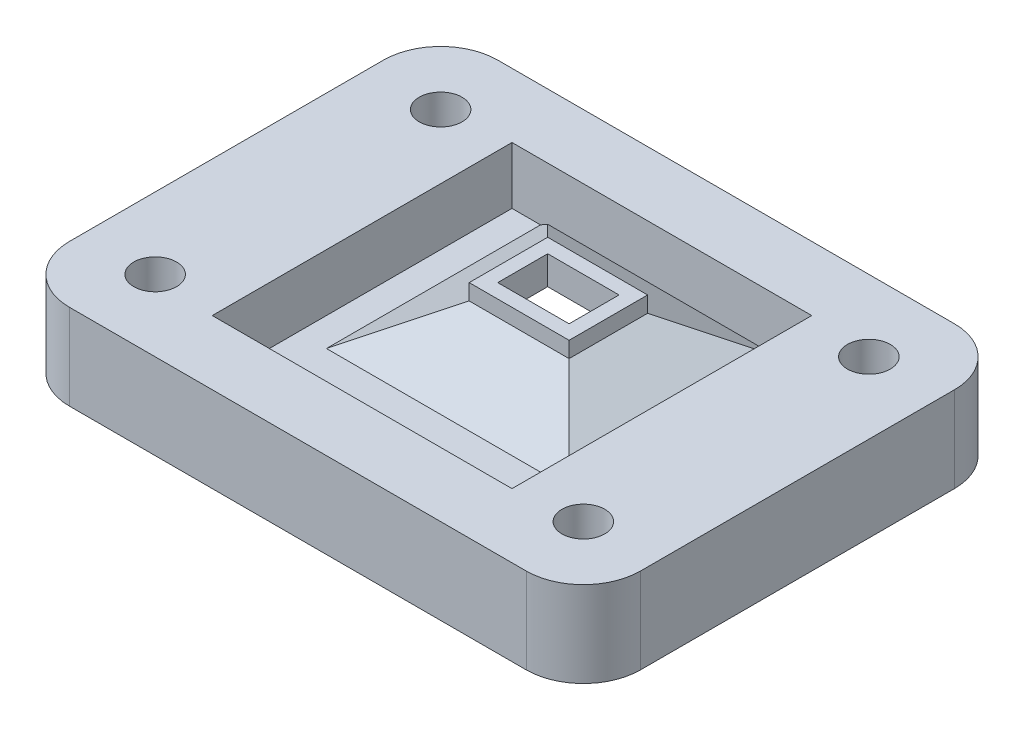
from build123d import *
from OCP.BRepFilletAPI import BRepFilletAPI_MakeChamfer

# Parameters (mm, degrees)
SKETCH1_W           = 40
SKETCH1_H           = 30
BOSS_EXTRUDE1_DEPTH = 6
SKETCH2_R           = 1.5
CUT_EXTRUDE1_DEPTH  = 6
FILLET1_R           = 4
SKETCH3_W           = 21
SKETCH3_H           = 21
CUT_EXTRUDE2_DEPTH  = 4
SKETCH6_W           = 5
SKETCH6_H           = 3.5
CUT_EXTRUDE3_DEPTH  = 2
SKETCH7_W           = 7
SKETCH7_H           = 5.5
SKETCH7_W_2         = 5
SKETCH7_H_2         = 3.5
BOSS_EXTRUDE2_DEPTH = 4
CHAMFER1_SIZE       = 4
CHAMFER1_SIZE2      = 6.92820323
CHAMFER2_SIZE       = 2.886751346
CHAMFER2_SIZE_2     = 5


with BuildPart() as part:
    # Sketch1 → Boss-Extrude1 (new body)
    with BuildSketch(Plane(origin=(0, 0, 0), x_dir=(1, 0, 0), z_dir=(0, 1, 0))):
        with Locations((20, 15)):
            Rectangle(SKETCH1_W, SKETCH1_H)
    extrude(amount=BOSS_EXTRUDE1_DEPTH)

    # Sketch2 → Cut-Extrude1 (cut)
    with BuildSketch(Plane(origin=(0, 6, 0), x_dir=(1, 0, 0), z_dir=(0, 1, 0))):
        with Locations(Location((5, 5, 0), (0, 0, 270))):
            Circle(SKETCH2_R)
        with Locations(Location((5, 25, 0), (0, 0, 90))):
            Circle(SKETCH2_R)
        with Locations(Location((35, 5, 0), (0, 0, 90))):
            Circle(SKETCH2_R)
        with Locations(Location((35, 25, 0), (0, 0, 270))):
            Circle(SKETCH2_R)
    extrude(amount=-CUT_EXTRUDE1_DEPTH, mode=Mode.SUBTRACT)

    # Fillet1
    fillet1_edges = [part.edges().sort_by_distance(p)[0] for p in [
        (0, 3, -30),
        (40, 3, -30),
        (40, 3, 0),
        (0, 3, 0),
    ]]
    fillet(fillet1_edges, radius=FILLET1_R)

    # Sketch3 → Cut-Extrude2 (cut)
    with BuildSketch(Plane(origin=(0, 6, 0), x_dir=(1, 0, 0), z_dir=(0, 1, 0))):
        with Locations((20, 15)):
            Rectangle(SKETCH3_W, SKETCH3_H)
    extrude(amount=-CUT_EXTRUDE2_DEPTH, mode=Mode.SUBTRACT)

    # Sketch6 → Cut-Extrude3 (cut)
    with BuildSketch(Plane(origin=(0, 2, 0), x_dir=(1, 0, 0), z_dir=(0, 1, 0))):
        with Locations((20, 18.25)):
            Rectangle(SKETCH6_W, SKETCH6_H)
    extrude(amount=-CUT_EXTRUDE3_DEPTH, mode=Mode.SUBTRACT)

    # Sketch7 → Boss-Extrude2 (add)
    with BuildSketch(Plane(origin=(0, 2, 0), x_dir=(1, 0, 0), z_dir=(0, 1, 0))):
        with Locations((20, 18.25)):
            Rectangle(SKETCH7_W, SKETCH7_H)
        with Locations((20, 18.25)):
            Rectangle(SKETCH7_W_2, SKETCH7_H_2, mode=Mode.SUBTRACT)
    extrude(amount=BOSS_EXTRUDE2_DEPTH)

    # Chamfer1: one chamfer whose edges measure the first distance from different faces: ONE call of the kernel's chamfer builder (chamfer() names one face for all edges)
    chamfer1_edges_1 = [part.edges().sort_by_distance(p)[0] for p in [
        (20, 0, -16.5),
    ]]
    chamfer1_side_1 = [part.faces().sort_by_distance(p)[0] for p in [
        (20, 3, -16.5),
    ]]
    chamfer1_edges_2 = [part.edges().sort_by_distance(p)[0] for p in [
        (22.5, 0, -18.25),
    ]]
    chamfer1_side_2 = [part.faces().sort_by_distance(p)[0] for p in [
        (22.5, 3, -18.25),
    ]]
    chamfer1_edges_3 = [part.edges().sort_by_distance(p)[0] for p in [
        (20, 0, -20),
    ]]
    chamfer1_side_3 = [part.faces().sort_by_distance(p)[0] for p in [
        (20, 3, -20),
    ]]
    chamfer1_edges_4 = [part.edges().sort_by_distance(p)[0] for p in [
        (17.5, 0, -18.25),
    ]]
    chamfer1_side_4 = [part.faces().sort_by_distance(p)[0] for p in [
        (17.5, 3, -18.25),
    ]]
    chamfer1 = BRepFilletAPI_MakeChamfer(part.part.solid().wrapped)
    for e in chamfer1_edges_1:
        chamfer1.Add(CHAMFER1_SIZE, CHAMFER1_SIZE2, e.wrapped, chamfer1_side_1[0].wrapped)  # the first distance lies on this face
    for e in chamfer1_edges_2:
        chamfer1.Add(CHAMFER1_SIZE, CHAMFER1_SIZE2, e.wrapped, chamfer1_side_2[0].wrapped)  # the first distance lies on this face
    for e in chamfer1_edges_3:
        chamfer1.Add(CHAMFER1_SIZE, CHAMFER1_SIZE2, e.wrapped, chamfer1_side_3[0].wrapped)  # the first distance lies on this face
    for e in chamfer1_edges_4:
        chamfer1.Add(CHAMFER1_SIZE, CHAMFER1_SIZE2, e.wrapped, chamfer1_side_4[0].wrapped)  # the first distance lies on this face
    add(Compound.cast(chamfer1.Shape()), mode=Mode.REPLACE)

    # Chamfer2
    # the kernel refuses this chamfer: 5, 2.886751346 mm, written as the material it adds along each edge
    with BuildSketch(Plane(origin=(16.5, 2, -33.935428773), x_dir=(0, 1, 0), z_dir=(0, 0, 1))) as chamfer2_piece_1_section:
        Polygon((CHAMFER2_SIZE, 0), (0, CHAMFER2_SIZE_2), (0, 0), align=None)
    chamfer2_piece_1 = extrude(amount=31.370857546, mode=Mode.PRIVATE)
    chamfer2_piece_1 = split(chamfer2_piece_1, bisect_by=Plane(origin=(15.883974596, 3.066987298, -33.935428773), z_dir=(-0.499999999999998, 0.8660254037844398, 0)), keep=Keep.TOP, mode=Mode.PRIVATE)
    chamfer2_piece_1 = split(chamfer2_piece_1, bisect_by=Plane(origin=(16.5, -1.436141454, -31.95157158), z_dir=(0, -0.8660254037844382, 0.500000000000001)), keep=Keep.TOP, mode=Mode.PRIVATE)
    chamfer2_piece_1 = split(chamfer2_piece_1, bisect_by=Plane(origin=(16.5, 12.147838333, -28.07657158), z_dir=(0, -0.8660254037844382, -0.500000000000001)), keep=Keep.TOP, mode=Mode.PRIVATE)
    with BuildSketch(Plane(origin=(16.5, 2, -33.935428773), x_dir=(0, 1, 0), z_dir=(0, 0, 1))) as chamfer2_piece_2_section:
        Polygon((CHAMFER2_SIZE, 0), (0, CHAMFER2_SIZE_2), (0, 0), align=None)
    chamfer2_piece_2 = extrude(amount=31.370857546, mode=Mode.PRIVATE)
    chamfer2_piece_2 = split(chamfer2_piece_2, bisect_by=Plane(origin=(16.5, -2.534217665, -31.317596984), z_dir=(0, 0.8660254037844398, -0.499999999999998)), keep=Keep.TOP, mode=Mode.PRIVATE)
    chamfer2_piece_2 = split(chamfer2_piece_2, bisect_by=Plane(origin=(16.5, -1.436141454, -31.95157158), z_dir=(0, -0.8660254037844382, 0.500000000000001)), keep=Keep.TOP, mode=Mode.PRIVATE)
    with BuildSketch(Plane(origin=(16.5, 2, -33.935428773), x_dir=(0, 1, 0), z_dir=(0, 0, 1))) as chamfer2_piece_3_section:
        Polygon((CHAMFER2_SIZE, 0), (0, CHAMFER2_SIZE_2), (0, 0), align=None)
    chamfer2_piece_3 = extrude(amount=31.370857546, mode=Mode.PRIVATE)
    chamfer2_piece_3 = split(chamfer2_piece_3, bisect_by=Plane(origin=(16.5, 11.049762122, -28.710546176), z_dir=(0, 0.8660254037844398, 0.499999999999998)), keep=Keep.TOP, mode=Mode.PRIVATE)
    chamfer2_piece_3 = split(chamfer2_piece_3, bisect_by=Plane(origin=(16.5, 12.147838333, -28.07657158), z_dir=(0, -0.8660254037844382, -0.500000000000001)), keep=Keep.TOP, mode=Mode.PRIVATE)
    with BuildSketch(Plane(origin=(3.564571227, 2, -15.5), x_dir=(0, 1, 0), z_dir=(1, 0, 0))) as chamfer2_piece_4_section:
        Polygon((CHAMFER2_SIZE, 0), (0, CHAMFER2_SIZE_2), (0, 0), align=None)
    chamfer2_piece_4 = extrude(amount=32.870857546, mode=Mode.PRIVATE)
    chamfer2_piece_4 = split(chamfer2_piece_4, bisect_by=Plane(origin=(3.564571227, 3.066987298, -14.883974596), z_dir=(0, 0.8660254037844398, 0.499999999999998)), keep=Keep.TOP, mode=Mode.PRIVATE)
    chamfer2_piece_4 = split(chamfer2_piece_4, bisect_by=Plane(origin=(9.79842842, 12.797357386, -15.5), z_dir=(-0.500000000000001, -0.8660254037844382, 0)), keep=Keep.TOP, mode=Mode.PRIVATE)
    chamfer2_piece_4 = split(chamfer2_piece_4, bisect_by=Plane(origin=(5.54842842, -1.436141454, -15.5), z_dir=(0.500000000000001, -0.8660254037844382, 0)), keep=Keep.TOP, mode=Mode.PRIVATE)
    with BuildSketch(Plane(origin=(3.564571227, 2, -15.5), x_dir=(0, 1, 0), z_dir=(1, 0, 0))) as chamfer2_piece_5_section:
        Polygon((CHAMFER2_SIZE, 0), (0, CHAMFER2_SIZE_2), (0, 0), align=None)
    chamfer2_piece_5 = extrude(amount=32.870857546, mode=Mode.PRIVATE)
    chamfer2_piece_5 = split(chamfer2_piece_5, bisect_by=Plane(origin=(6.182403016, -2.534217665, -15.5), z_dir=(-0.499999999999998, 0.8660254037844398, 0)), keep=Keep.TOP, mode=Mode.PRIVATE)
    chamfer2_piece_5 = split(chamfer2_piece_5, bisect_by=Plane(origin=(5.54842842, -1.436141454, -15.5), z_dir=(0.500000000000001, -0.8660254037844382, 0)), keep=Keep.TOP, mode=Mode.PRIVATE)
    with BuildSketch(Plane(origin=(23.5, 2, -2.564571227), x_dir=(0, 1, 0), z_dir=(0, 0, -1))) as chamfer2_piece_6_section:
        Polygon((CHAMFER2_SIZE, 0), (0, CHAMFER2_SIZE_2), (0, 0), align=None)
    chamfer2_piece_6 = extrude(amount=31.370857546, mode=Mode.PRIVATE)
    chamfer2_piece_6 = split(chamfer2_piece_6, bisect_by=Plane(origin=(24.116025404, 3.066987298, -2.564571227), z_dir=(0.499999999999998, 0.8660254037844398, 0)), keep=Keep.TOP, mode=Mode.PRIVATE)
    chamfer2_piece_6 = split(chamfer2_piece_6, bisect_by=Plane(origin=(23.5, 12.147838333, -8.42342842), z_dir=(0, -0.8660254037844382, 0.500000000000001)), keep=Keep.TOP, mode=Mode.PRIVATE)
    chamfer2_piece_6 = split(chamfer2_piece_6, bisect_by=Plane(origin=(23.5, -1.436141454, -4.54842842), z_dir=(0, -0.8660254037844382, -0.500000000000001)), keep=Keep.TOP, mode=Mode.PRIVATE)
    with BuildSketch(Plane(origin=(23.5, 2, -2.564571227), x_dir=(0, 1, 0), z_dir=(0, 0, -1))) as chamfer2_piece_7_section:
        Polygon((CHAMFER2_SIZE, 0), (0, CHAMFER2_SIZE_2), (0, 0), align=None)
    chamfer2_piece_7 = extrude(amount=31.370857546, mode=Mode.PRIVATE)
    chamfer2_piece_7 = split(chamfer2_piece_7, bisect_by=Plane(origin=(23.5, -2.534217665, -5.182403016), z_dir=(0, 0.8660254037844398, 0.499999999999998)), keep=Keep.TOP, mode=Mode.PRIVATE)
    chamfer2_piece_7 = split(chamfer2_piece_7, bisect_by=Plane(origin=(23.5, -1.436141454, -4.54842842), z_dir=(0, -0.8660254037844382, -0.500000000000001)), keep=Keep.TOP, mode=Mode.PRIVATE)
    with BuildSketch(Plane(origin=(23.5, 2, -2.564571227), x_dir=(0, 1, 0), z_dir=(0, 0, -1))) as chamfer2_piece_8_section:
        Polygon((CHAMFER2_SIZE, 0), (0, CHAMFER2_SIZE_2), (0, 0), align=None)
    chamfer2_piece_8 = extrude(amount=31.370857546, mode=Mode.PRIVATE)
    chamfer2_piece_8 = split(chamfer2_piece_8, bisect_by=Plane(origin=(23.5, 11.049762122, -7.789453824), z_dir=(0, 0.8660254037844398, -0.499999999999998)), keep=Keep.TOP, mode=Mode.PRIVATE)
    chamfer2_piece_8 = split(chamfer2_piece_8, bisect_by=Plane(origin=(23.5, 12.147838333, -8.42342842), z_dir=(0, -0.8660254037844382, 0.500000000000001)), keep=Keep.TOP, mode=Mode.PRIVATE)
    with BuildSketch(Plane(origin=(36.435428773, 2, -21), x_dir=(0, 1, 0), z_dir=(-1, 0, 0))) as chamfer2_piece_9_section:
        Polygon((CHAMFER2_SIZE, 0), (0, CHAMFER2_SIZE_2), (0, 0), align=None)
    chamfer2_piece_9 = extrude(amount=32.870857546, mode=Mode.PRIVATE)
    chamfer2_piece_9 = split(chamfer2_piece_9, bisect_by=Plane(origin=(36.435428773, 3.066987298, -21.616025404), z_dir=(0, 0.8660254037844398, -0.499999999999998)), keep=Keep.TOP, mode=Mode.PRIVATE)
    chamfer2_piece_9 = split(chamfer2_piece_9, bisect_by=Plane(origin=(34.45157158, -1.436141454, -21), z_dir=(-0.500000000000001, -0.8660254037844382, 0)), keep=Keep.TOP, mode=Mode.PRIVATE)
    chamfer2_piece_9 = split(chamfer2_piece_9, bisect_by=Plane(origin=(30.20157158, 12.797357386, -21), z_dir=(0.500000000000001, -0.8660254037844382, 0)), keep=Keep.TOP, mode=Mode.PRIVATE)
    with BuildSketch(Plane(origin=(36.435428773, 2, -21), x_dir=(0, 1, 0), z_dir=(-1, 0, 0))) as chamfer2_piece_10_section:
        Polygon((CHAMFER2_SIZE, 0), (0, CHAMFER2_SIZE_2), (0, 0), align=None)
    chamfer2_piece_10 = extrude(amount=32.870857546, mode=Mode.PRIVATE)
    chamfer2_piece_10 = split(chamfer2_piece_10, bisect_by=Plane(origin=(30.835546176, 11.699281175, -21), z_dir=(-0.499999999999998, 0.8660254037844398, 0)), keep=Keep.TOP, mode=Mode.PRIVATE)
    chamfer2_piece_10 = split(chamfer2_piece_10, bisect_by=Plane(origin=(30.20157158, 12.797357386, -21), z_dir=(0.500000000000001, -0.8660254037844382, 0)), keep=Keep.TOP, mode=Mode.PRIVATE)
    add([chamfer2_piece_1, chamfer2_piece_2, chamfer2_piece_3, chamfer2_piece_4, chamfer2_piece_5, chamfer2_piece_6, chamfer2_piece_7, chamfer2_piece_8, chamfer2_piece_9, chamfer2_piece_10])


solid = part.part
